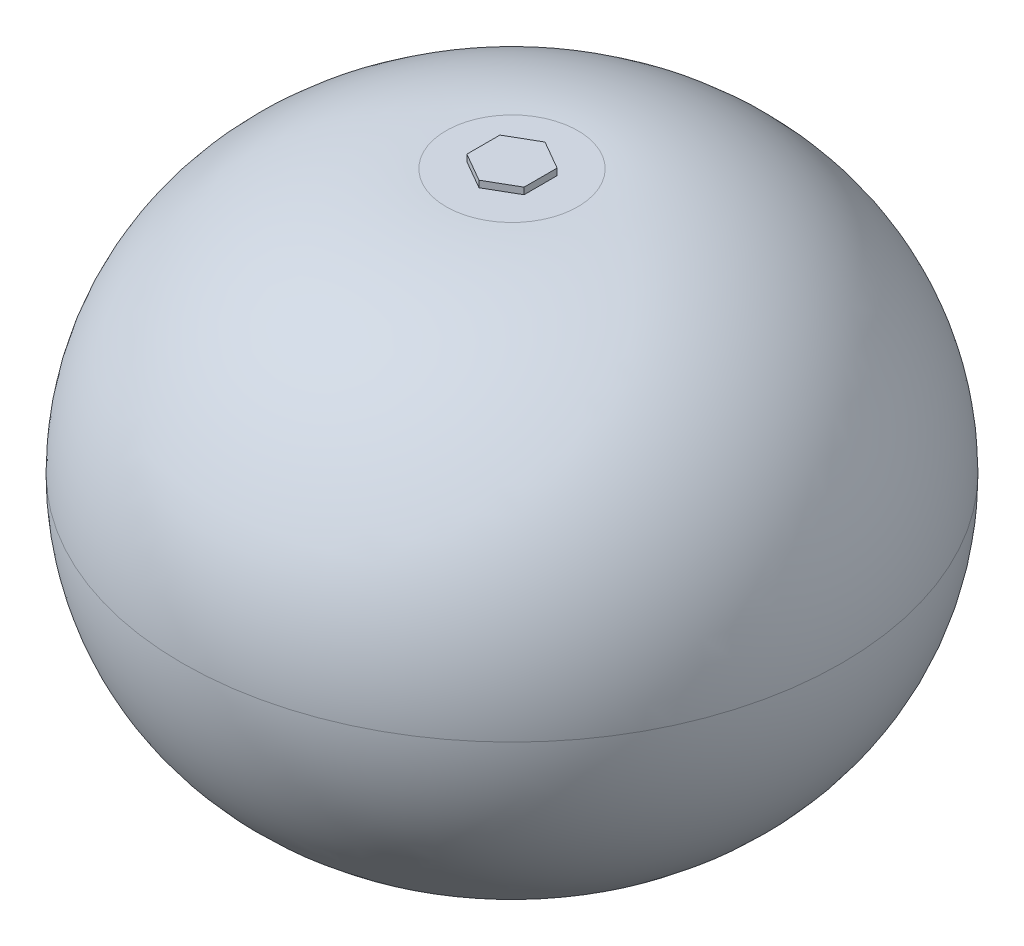
from build123d import *

# Parameters (mm, degrees)
SKETCH2_R           = 25
BOSS_EXTRUDE5_DEPTH = 20
FILLET8_R           = 20
BOSS_EXTRUDE6_DEPTH = 0.5


with BuildPart() as part:
    # Sketch2 → Boss-Extrude5 (new, symmetric)
    with BuildSketch(Plane(origin=(0, 0, 0), x_dir=(1, 0, 0), z_dir=(0, 1, 0))):
        with Locations(Location((0, 0, 0), (0, 0, 270))):
            Circle(SKETCH2_R)
    extrude(amount=BOSS_EXTRUDE5_DEPTH, both=True)

    # Fillet8
    fillet8_edges = [part.edges().sort_by_distance(p)[0] for p in [
        (0, -20, -25),
        (0, 20, -25),
    ]]
    fillet(fillet8_edges, radius=FILLET8_R - 0.0001)  # a hair under: the kernel refuses the full size

    # Sketch3 → Boss-Extrude6 (add)
    with BuildSketch(Plane(origin=(0, 20, 0), x_dir=(1, 0, 0), z_dir=(0, 1, 0))):
        Polygon((0, 2.504821992), (-2.169239477, 1.252410996), (-2.169239477, -1.252410996), (0, -2.504821992), (2.169239477, -1.252410996), (2.169239477, 1.252410996), align=None)
    extrude(amount=BOSS_EXTRUDE6_DEPTH)


solid = part.part
